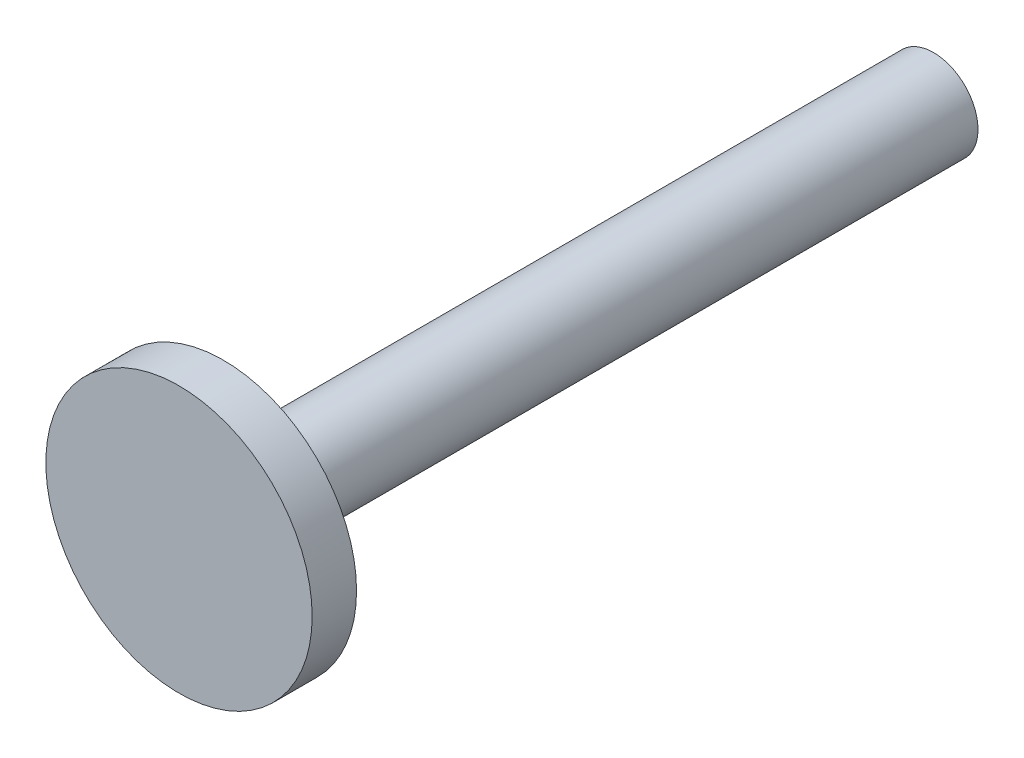
from build123d import *

# Parameters (mm, degrees)
BOSS_EXTRUDE1_DEPTH      = 10
BOSS_EXTRUDE1_DEPTH_BACK = 150
SKETCH1_R                = 10
SKETCH2_R                = 30
BOSS_EXTRUDE2_DEPTH      = 10
SHELL1_START             = -149
SHELL1_OUTLINE_R         = 9
SHELL1_DEPTH             = 168
SHELL1_START_2           = 11
SHELL1_2_OUTLINE_R       = 29
SHELL1_2_OUTLINE_R_2     = 9
SHELL1_2_DEPTH           = 8


# Read off the part's stored shape, not the designer's step: Shell1
with BuildPart() as part:
    # Sketch1 → Boss-Extrude1 (new, two sides: drawn at the far end of the back side and taken through both)
    with BuildSketch(Plane.XY.offset(-BOSS_EXTRUDE1_DEPTH_BACK)):
        Circle(SKETCH1_R)
    extrude(amount=BOSS_EXTRUDE1_DEPTH + BOSS_EXTRUDE1_DEPTH_BACK)

    # Sketch2 → Boss-Extrude2 (add)
    with BuildSketch(Plane.XY.offset(10)):
        Circle(SKETCH2_R)
    extrude(amount=BOSS_EXTRUDE2_DEPTH)

    # Shell1 outline → Shell1 (cut)
    with BuildSketch(Plane.XY.offset(SHELL1_START)):
        Circle(SHELL1_OUTLINE_R)
    extrude(amount=SHELL1_DEPTH, mode=Mode.SUBTRACT)

    # Shell1 2 outline → Shell1 2 (cut)
    with BuildSketch(Plane.XY.offset(SHELL1_START_2)):
        Circle(SHELL1_2_OUTLINE_R)
        Circle(SHELL1_2_OUTLINE_R_2, mode=Mode.SUBTRACT)
    extrude(amount=SHELL1_2_DEPTH, mode=Mode.SUBTRACT)


solid = part.part
